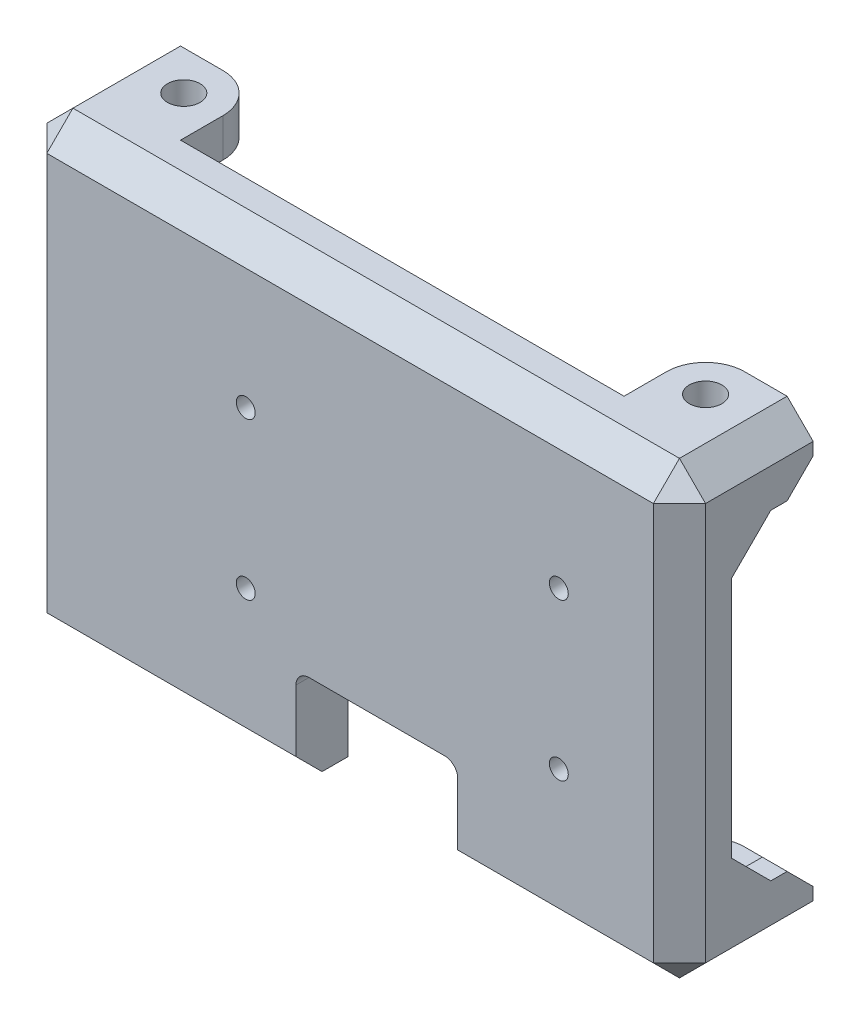
from build123d import *

# Parameters (mm, degrees)
SKETCH1_W           = 46.5
SKETCH1_H           = 34.5
BOSS_EXTRUDE1_DEPTH = 4
SKETCH2_W           = 46.5
SKETCH2_H           = 2.95
BOSS_EXTRUDE2_DEPTH = 6.5
SKETCH3_R           = 1.25
CUT_EXTRUDE1_DEPTH  = 43.907604221
CUT_EXTRUDE8_DEPTH  = 43.907604221
SKETCH5_R           = 0.725
CUT_EXTRUDE3_DEPTH  = 31.711357834
SKETCH21_W          = 12.4
SKETCH21_H          = 8.2
CUT_EXTRUDE11_DEPTH = 31.711357834
BOSS_EXTRUDE3_DEPTH = 0.1
BOSS_EXTRUDE4_DEPTH = 0.1
SKETCH17_W          = 10.25
SKETCH17_H          = 34.5
BOSS_EXTRUDE6_DEPTH = 1.9
SKETCH18_W          = 10.25
SKETCH18_H          = 34.5
BOSS_EXTRUDE7_DEPTH = 1.9
CUT_EXTRUDE10_DEPTH = 55.340362531
CHAMFER1_SIZE       = 2
FILLET2_R           = 1
CUT_EXTRUDE12_DEPTH = 2
SKETCH23_W          = 10.25
SKETCH23_H          = 34.5
CUT_EXTRUDE13_DEPTH = 55.340362531


# Read off the part's stored shape, not the designer's step: Mirror1
with BuildPart() as part:
    # Sketch1 → Boss-Extrude1 (new body)
    with BuildSketch(Plane.XY):
        Rectangle(SKETCH1_W, SKETCH1_H)
    extrude(amount=BOSS_EXTRUDE1_DEPTH)

    # Sketch2 → Boss-Extrude2 (add)
    with BuildSketch(Plane.XY.offset(4)):
        with Locations((0, 15.775)):
            Rectangle(SKETCH2_W, SKETCH2_H)
        with Locations((0, -15.775)):
            Rectangle(SKETCH2_W, SKETCH2_H)
    extrude(amount=BOSS_EXTRUDE2_DEPTH)

    # Sketch3 → Cut-Extrude1 (cut, through all)
    with BuildSketch(Plane(origin=(0, 17.25, 0), x_dir=(1, 0, 0), z_dir=(0, 1, 0))):
        with Locations(Location((-20, -7.25, 0), (0, 0, 270))):
            Circle(SKETCH3_R)
        with Locations(Location((20, -7.25, 0), (0, 0, 270))):
            Circle(SKETCH3_R)
    extrude(amount=-CUT_EXTRUDE1_DEPTH, mode=Mode.SUBTRACT)

    # Sketch11 → Cut-Extrude8 (cut, through all)
    with BuildSketch(Plane(origin=(0, 17.25, 0), x_dir=(1, 0, 0), z_dir=(0, 1, 0))):
        with BuildLine():
            Line((-17, -7.25), (-17, -4))
            Line((-17, -4), (17, -4))
            Line((17, -4), (17, -7.25))
            ThreePointArc((17, -7.25), (17.878679656, -9.371320344), (20, -10.25))
            Line((20, -10.25), (23.25, -10.25))
            Line((23.25, -10.25), (23.25, -10.5))
            Line((23.25, -10.5), (-23.25, -10.5))
            Line((-23.25, -10.5), (-23.25, -10.25))
            Line((-23.25, -10.25), (-20, -10.25))
            ThreePointArc((-20, -10.25), (-17.878679656, -9.371320344), (-17, -7.25))
        make_face()
    extrude(amount=-CUT_EXTRUDE8_DEPTH, mode=Mode.SUBTRACT)

    # Sketch5 → Cut-Extrude3 (cut, through all)
    with BuildSketch(Plane(origin=(0, 0, 0), x_dir=(-1, 0, 0), z_dir=(0, 0, -1))):
        with Locations((8, 6)):
            Circle(SKETCH5_R)
        with Locations((8, -6)):
            Circle(SKETCH5_R)
        with Locations((-16, -6)):
            Circle(SKETCH5_R)
        with Locations((-16, 6)):
            Circle(SKETCH5_R)
    extrude(amount=-CUT_EXTRUDE3_DEPTH, mode=Mode.SUBTRACT)

    # Sketch21 → Cut-Extrude11 (cut, through all)
    with BuildSketch(Plane(origin=(0, 0, 0), x_dir=(-1, 0, 0), z_dir=(0, 0, -1))):
        with Locations((-2.05, -13.6)):
            Rectangle(SKETCH21_W, SKETCH21_H)
    extrude(amount=-CUT_EXTRUDE11_DEPTH, mode=Mode.SUBTRACT)

    # Sketch14 → Boss-Extrude3 (add)
    with BuildSketch(Plane.ZY.offset(23.25)):
        Polygon((10.25, 17.25), (0, 17.25), (0, -17.25), (10.25, -17.25), (10.25, -14.3), (4, -14.3), (4, 14.3), (10.25, 14.3), align=None)
    extrude(amount=BOSS_EXTRUDE3_DEPTH)

    # Sketch15 → Boss-Extrude4 (add)
    with BuildSketch(Plane(origin=(23.25, 0, 0), x_dir=(0, 0, -1), z_dir=(1, 0, 0))):
        Polygon((-10.25, -17.25), (0, -17.25), (0, 17.25), (-10.25, 17.25), (-10.25, 14.3), (-4, 14.3), (-4, -14.3), (-10.25, -14.3), align=None)
    extrude(amount=BOSS_EXTRUDE4_DEPTH)

    # Sketch17 → Boss-Extrude6 (add)
    with BuildSketch(Plane.ZY.offset(23.35)):
        with Locations((5.125, 0)):
            Rectangle(SKETCH17_W, SKETCH17_H)
    extrude(amount=BOSS_EXTRUDE6_DEPTH)

    # Sketch18 → Boss-Extrude7 (add)
    with BuildSketch(Plane(origin=(23.35, 0, 0), x_dir=(0, 0, -1), z_dir=(1, 0, 0))):
        with Locations((-5.125, 0)):
            Rectangle(SKETCH18_W, SKETCH18_H)
    extrude(amount=BOSS_EXTRUDE7_DEPTH)

    # Sketch19 → Cut-Extrude10 (cut, through all)
    with BuildSketch(Plane.ZY.offset(25.25)):
        Polygon((10.25, 12.3), (7, 12.3), (4, 9.3), (4, -9.3), (7, -12.3), (10.25, -12.3), align=None)
    extrude(amount=-CUT_EXTRUDE10_DEPTH, mode=Mode.SUBTRACT)

    # Chamfer1
    chamfer1_edges = [part.edges().sort_by_distance(p)[0] for p in [
        (-24.3, -12.3, 10.25),
        (-24.3, 12.3, 10.25),
        (24.3, -12.3, 10.25),
        (24.3, 12.3, 10.25),
        (-14.7, -17.25, 0),
        (16.75, -17.25, 0),
        (-25.25, 0, 0),
        (0, 17.25, 0),
        (25.25, 0, 0),
        (25.25, 17.25, 5.125),
        (25.25, -17.25, 5.125),
        (-25.25, -17.25, 5.125),
        (-25.25, 17.25, 5.125),
    ]]
    chamfer(chamfer1_edges, length=CHAMFER1_SIZE)

    # Fillet2
    fillet2_edges = [part.edges().sort_by_distance(p)[0] for p in [
        (-4.15, -9.5, 2),
        (8.25, -9.5, 2),
    ]]
    fillet(fillet2_edges, radius=FILLET2_R)

    # Sketch22 → Cut-Extrude12 (cut)
    with BuildSketch(Plane.XY.offset(4)):
        Polygon((-7.133974596, 4.5), (-6.267949192, 6), (-7.133974596, 7.5), (-8.866025404, 7.5), (-9.732050808, 6), (-8.866025404, 4.5), align=None)
        Polygon((-7.133974596, -7.5), (-6.267949192, -6), (-7.133974596, -4.5), (-8.866025404, -4.5), (-9.732050808, -6), (-8.866025404, -7.5), align=None)
        Polygon((16.866025404, -7.5), (17.732050808, -6), (16.866025404, -4.5), (15.133974596, -4.5), (14.267949192, -6), (15.133974596, -7.5), align=None)
        Polygon((16.866025404, 4.5), (17.732050808, 6), (16.866025404, 7.5), (15.133974596, 7.5), (14.267949192, 6), (15.133974596, 4.5), align=None)
    extrude(amount=-CUT_EXTRUDE12_DEPTH, mode=Mode.SUBTRACT)

    # Mirror1: part across plane


with BuildPart() as part_1:
    add(part.part)
    add(part.part.mirror(Plane.XY))

    # Sketch23 → Cut-Extrude13 (cut, through all)
    with BuildSketch(Plane.ZY.offset(25.25)):
        with Locations((5.125, 0)):
            Rectangle(SKETCH23_W, SKETCH23_H)
    extrude(amount=-CUT_EXTRUDE13_DEPTH, mode=Mode.SUBTRACT)


solid = part_1.part
